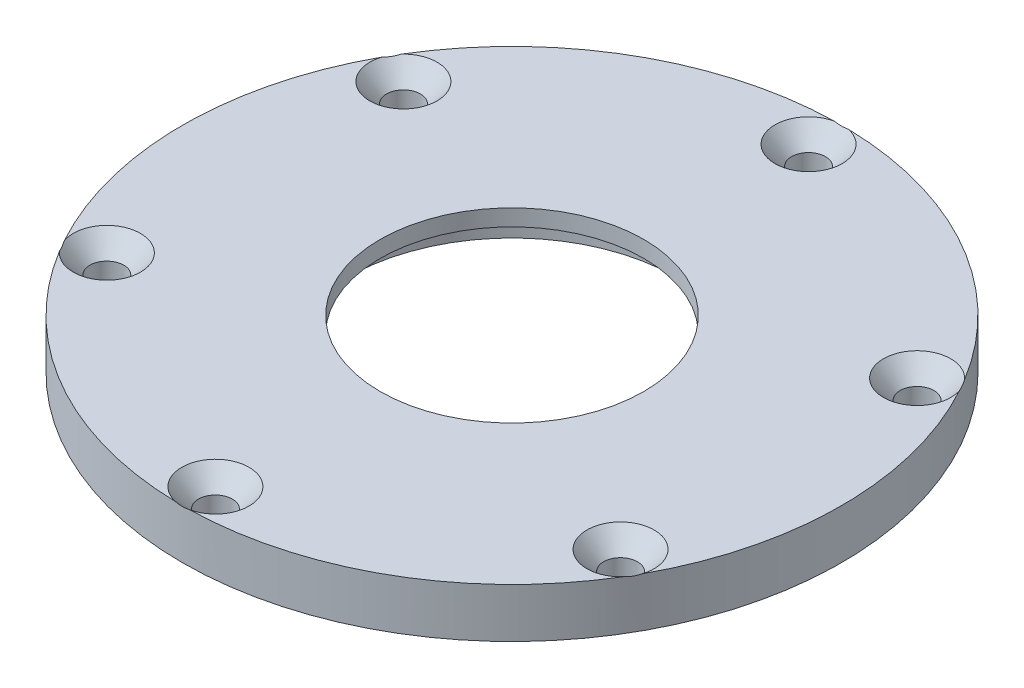
from build123d import *

# Parameters (mm, degrees)
SKETCH1_R                                         = 31.75
BOSS_EXTRUDE1_DEPTH                               = 4.7625
CSK_FOR_4_FLAT_HEAD_SOCKET_CAP_SCREW1_D           = 3.2639
CSK_FOR_4_FLAT_HEAD_SOCKET_CAP_SCREW1_CSINK_D     = 6.477
CSK_FOR_4_FLAT_HEAD_SOCKET_CAP_SCREW1_CSINK_ANGLE = 82
SKETCH6_R                                         = 15.875
CUT_EXTRUDE1_DEPTH                                = 3.175
SKETCH7_R                                         = 12.7
CUT_EXTRUDE2_DEPTH                                = 3.175
SKETCH8_R                                         = 17.4625
CUT_EXTRUDE3_DEPTH                                = 3.175


with BuildPart() as part:
    # Sketch1 → Boss-Extrude1 (new body)
    with BuildSketch(Plane(origin=(0, 0, 0), x_dir=(1, 0, 0), z_dir=(0, 1, 0))):
        Circle(SKETCH1_R)
    extrude(amount=BOSS_EXTRUDE1_DEPTH)

    # CSK for #4 Flat Head Socket Cap Screw1 (through all)
    with Locations(Plane(origin=(0, 4.7625, 0), x_dir=(-1, 0, 0), z_dir=(0, 1, 0))):
        with Locations((0, 28.575), (24.746675913, 14.2875), (24.746675913, -14.2875), (0, -28.575), (-24.746675913, -14.2875), (-24.746675913, 14.2875)):
            CounterSinkHole(CSK_FOR_4_FLAT_HEAD_SOCKET_CAP_SCREW1_D / 2, CSK_FOR_4_FLAT_HEAD_SOCKET_CAP_SCREW1_CSINK_D / 2, counter_sink_angle=CSK_FOR_4_FLAT_HEAD_SOCKET_CAP_SCREW1_CSINK_ANGLE)

    # Sketch6 → Cut-Extrude1 (cut)
    with BuildSketch(Plane.XZ):
        Circle(SKETCH6_R)
    extrude(amount=-CUT_EXTRUDE1_DEPTH, mode=Mode.SUBTRACT)

    # Sketch7 → Cut-Extrude2 (cut)
    with BuildSketch(Plane.XZ.offset(-3.175)):
        Circle(SKETCH7_R)
    extrude(amount=-CUT_EXTRUDE2_DEPTH, mode=Mode.SUBTRACT)

    # Sketch8 → Cut-Extrude3 (cut)
    with BuildSketch(Plane.XZ):
        with BuildLine():
            ThreePointArc((3.166972154, 28.349362296), (0, 25.4), (-3.166972154, 28.349362296))
            ThreePointArc((-3.166972154, 28.349362296), (-3.763919405, 29.475012331), (-4.998374065, 29.790536836))
            ThreePointArc((-4.998374065, 29.790536836), (-15.103475, 26.159986071), (-23.30017466, 19.223987337))
            ThreePointArc((-23.30017466, 19.223987337), (-23.644149753, 17.997155988), (-22.967781852, 16.917359487))
            ThreePointArc((-22.967781852, 16.917359487), (-21.942338768, 15.776230391), (-21.571675913, 14.2875))
            ThreePointArc((-21.571675913, 14.2875), (-23.062413901, 11.596053089), (-26.134754006, 11.432002809))
            ThreePointArc((-26.134754006, 11.432002809), (-27.408069158, 11.477856343), (-28.298548725, 10.5665495))
            ThreePointArc((-28.298548725, 10.5665495), (-30.20695, 0), (-28.298548725, -10.5665495))
            ThreePointArc((-28.298548725, -10.5665495), (-27.408069158, -11.477856343), (-26.134754006, -11.432002809))
            ThreePointArc((-26.134754006, -11.432002809), (-23.062413901, -11.596053089), (-21.571675913, -14.2875))
            ThreePointArc((-21.571675913, -14.2875), (-21.942338768, -15.776230391), (-22.967781852, -16.917359487))
            ThreePointArc((-22.967781852, -16.917359487), (-23.644149753, -17.997155988), (-23.30017466, -19.223987337))
            ThreePointArc((-23.30017466, -19.223987337), (-15.103475, -26.159986071), (-4.998374065, -29.790536836))
            ThreePointArc((-4.998374065, -29.790536836), (-3.763919405, -29.475012331), (-3.166972154, -28.349362296))
            ThreePointArc((-3.166972154, -28.349362296), (0, -25.4), (3.166972154, -28.349362296))
            ThreePointArc((3.166972154, -28.349362296), (3.763919405, -29.475012331), (4.998374065, -29.790536836))
            ThreePointArc((4.998374065, -29.790536836), (15.103475, -26.159986071), (23.30017466, -19.223987337))
            ThreePointArc((23.30017466, -19.223987337), (23.644149753, -17.997155988), (22.967781852, -16.917359487))
            ThreePointArc((22.967781852, -16.917359487), (21.997045256, -12.7), (26.134754006, -11.432002809))
            ThreePointArc((26.134754006, -11.432002809), (27.408069158, -11.477856343), (28.298548725, -10.5665495))
            ThreePointArc((28.298548725, -10.5665495), (30.20695, 0), (28.298548725, 10.5665495))
            ThreePointArc((28.298548725, 10.5665495), (27.408069158, 11.477856343), (26.134754006, 11.432002809))
            ThreePointArc((26.134754006, 11.432002809), (21.997045256, 12.7), (22.967781852, 16.917359487))
            ThreePointArc((22.967781852, 16.917359487), (23.644149753, 17.997155988), (23.30017466, 19.223987337))
            ThreePointArc((23.30017466, 19.223987337), (15.103475, 26.159986071), (4.998374065, 29.790536836))
            ThreePointArc((4.998374065, 29.790536836), (3.763919405, 29.475012331), (3.166972154, 28.349362296))
        make_face()
        Circle(SKETCH8_R, mode=Mode.SUBTRACT)
    extrude(amount=-CUT_EXTRUDE3_DEPTH, mode=Mode.SUBTRACT)


solid = part.part
